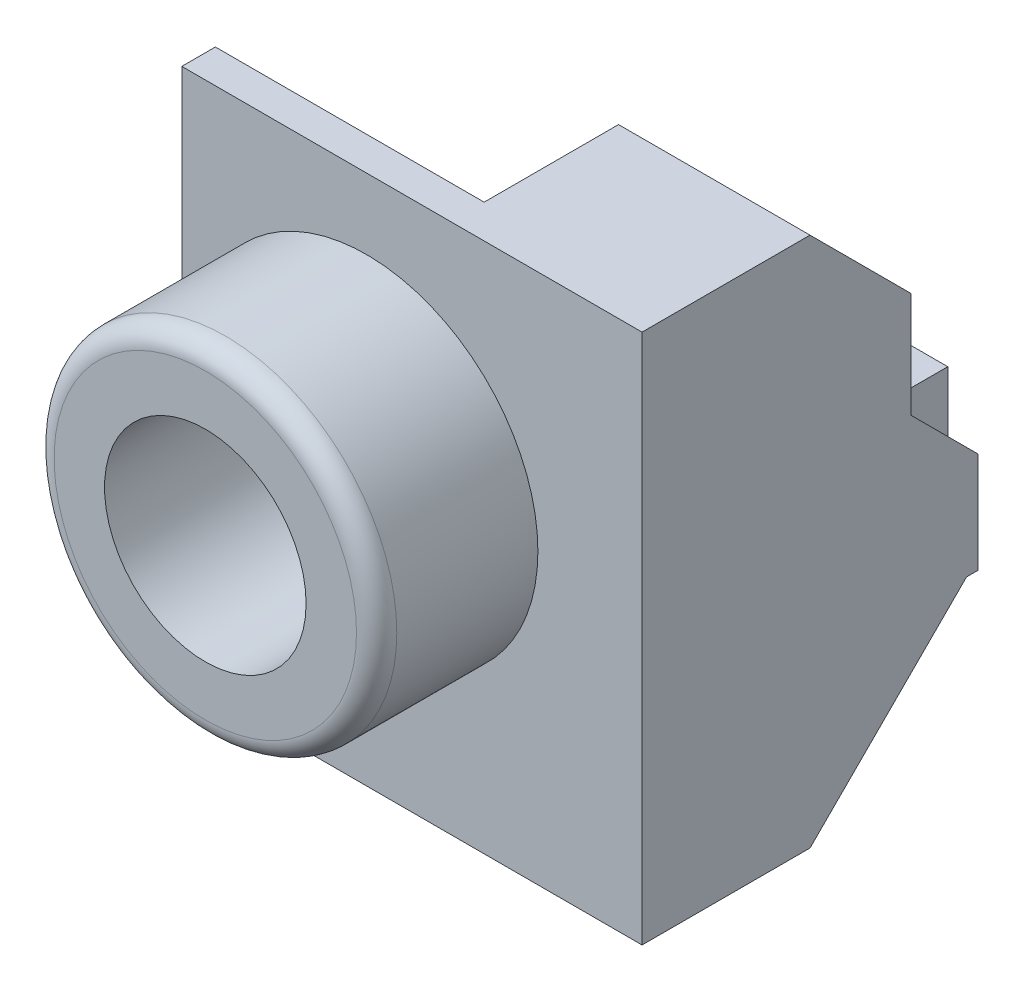
from build123d import *

# Parameters (mm, degrees)
SKETCH_3_R          = 5.1
EXTRUDE_1_DEPTH     = 4.8
SKETCH_4_W          = 11
SKETCH_4_H          = 15.8
EXTRUDE_2_DEPTH     = 1
SKETCH_5_R          = 1.5
EXTRUDE_3_DEPTH     = 10.8
CUT_EXTRUDE_1_DEPTH = 10.8
FILLET_1_R          = 0.6
SKETCH_8_R          = 3
CUT_EXTRUDE_2_DEPTH = 4.8
SKETCH_9_R          = 1
CUT_EXTRUDE_3_DEPTH = 1
SKETCH_10_W         = 3
SKETCH_10_H         = 15.8
EXTRUDE_4_DEPTH     = 7
CHAMFER_1_SIZE      = 3
SKETCH_11_W         = 2.584868303
SKETCH_11_H         = 3
EXTRUDE_5_DEPTH     = 10
CHAMFER_4_SIZE      = 1.6584
CHAMFER_5_SIZE      = 2
CHAMFER_6_SIZE      = 2
EXTRUDE_6_DEPTH     = 2.7


# Read off the part's stored shape, not the designer's step: Бобышка-Вытянуть6
with BuildPart() as part:
    # Эскиз3 → Бобышка-Вытянуть1 (new body)
    with BuildSketch(Plane.XY):
        with Locations((0, -6.52)):
            Circle(SKETCH_3_R)
    extrude(amount=EXTRUDE_1_DEPTH)

    # Эскиз4 → Бобышка-Вытянуть2 (add)
    with BuildSketch(Plane(origin=(0, 0, 0), x_dir=(-1, 0, 0), z_dir=(0, 0, -1))):
        with Locations((0, -7.22)):
            Rectangle(SKETCH_4_W, SKETCH_4_H)
    extrude(amount=EXTRUDE_2_DEPTH)

    # Эскиз5 → Бобышка-Вытянуть3 (add)
    with BuildSketch(Plane(origin=(0, 0, -1), x_dir=(-1, 0, 0), z_dir=(0, 0, -1))):
        with Locations(Location((-4.415131697, -8.961534596, 0), (0, 0, 136.323092078))):
            Circle(SKETCH_5_R)
    extrude(amount=EXTRUDE_3_DEPTH)

    # Эскиз6 → Вырез-Вытянуть1 (cut)
    with BuildSketch(Plane.XY.offset(-1)):
        with BuildLine():
            Line((5.5, -7.925648132), (5.5, -9.997421059))
            ThreePointArc((5.5, -9.997421059), (5.915131697, -8.961534596), (5.5, -7.925648132))
        make_face()
    extrude(amount=-CUT_EXTRUDE_1_DEPTH, mode=Mode.SUBTRACT)

    # Скругление1
    fillet_1_edges = [part.edges().sort_by_distance(p)[0] for p in [
        (-5.1, -6.52, 4.8),
    ]]
    fillet(fillet_1_edges, radius=FILLET_1_R)

    # Эскиз8 → Вырез-Вытянуть2 (cut)
    with BuildSketch(Plane.XY.offset(4.8)):
        with Locations((0, -6.52)):
            Circle(SKETCH_8_R)
    extrude(amount=-CUT_EXTRUDE_2_DEPTH, mode=Mode.SUBTRACT)

    # Эскиз9 → Вырез-Вытянуть3 (cut)
    with BuildSketch(Plane.XY):
        with Locations((0, -6.52)):
            Circle(SKETCH_9_R)
    extrude(amount=-CUT_EXTRUDE_3_DEPTH, mode=Mode.SUBTRACT)

    # Эскиз10 → Бобышка-Вытянуть4 (add)
    with BuildSketch(Plane(origin=(0, 0, -1), x_dir=(-1, 0, 0), z_dir=(0, 0, -1))):
        with Locations((-4, -7.22)):
            Rectangle(SKETCH_10_W, SKETCH_10_H)
    extrude(amount=EXTRUDE_4_DEPTH)

    # Фаска1
    chamfer_1_edges = [part.edges().sort_by_distance(p)[0] for p in [
        (4, -15.12, -8),
        (4, 0.68, -8),
    ]]
    chamfer(chamfer_1_edges, length=CHAMFER_1_SIZE)

    # Эскиз11 → Бобышка-Вытянуть5 (add)
    with BuildSketch(Plane(origin=(0, 0, -11.8), x_dir=(-1, 0, 0), z_dir=(0, 0, -1))):
        with Locations((-4.207565848, -8.961534596)):
            Rectangle(SKETCH_11_W, SKETCH_11_H)
    extrude(amount=-EXTRUDE_5_DEPTH)

    # Фаска4
    chamfer_4_edges = [part.edges().sort_by_distance(p)[0] for p in [
        (4.207565848, -10.461534596, -8),
    ]]
    chamfer(chamfer_4_edges, length=CHAMFER_4_SIZE)

    # Фаска5
    chamfer_5_edges = [part.edges().sort_by_distance(p)[0] for p in [
        (4.207565848, -7.461534596, -8),
    ]]
    chamfer(chamfer_5_edges, length=CHAMFER_5_SIZE)

    # Фаска6
    # the kernel refuses this chamfer: 2 mm, written as the material it adds along each edge
    with BuildSketch(Plane(origin=(2.915131697, -0.31816862, -8), x_dir=(-0.9996219169112968, 0, 0.027495876610586487), z_dir=(0, -1, 0))) as chamfer_6_piece_1_section:
        Polygon((CHAMFER_6_SIZE * 0.999621916911, CHAMFER_6_SIZE * 0.0274958766106), (-CHAMFER_6_SIZE * 0.0274958766106, CHAMFER_6_SIZE * 0.999621916911), (0, 0), align=None)
    chamfer_6_piece_1 = extrude(amount=16.945131952, mode=Mode.PRIVATE)
    chamfer_6_piece_1 = split(chamfer_6_piece_1, bisect_by=Plane(origin=(2.709078012, -6.449232398, -8.987697802), z_dir=(0, -0.7071067811865476, 0.7071067811865476)), keep=Keep.TOP, mode=Mode.PRIVATE)
    chamfer_6_piece_1 = split(chamfer_6_piece_1, bisect_by=Plane(origin=(2.709078012, -10.461534596, -8.650263736), z_dir=(0, 1, 0)), keep=Keep.TOP, mode=Mode.PRIVATE)
    chamfer_6_piece_1 = split(chamfer_6_piece_1, bisect_by=Plane(origin=(2.5, -6.786666464, -8.650263736), z_dir=(1, 0, 0)), keep=Keep.TOP, mode=Mode.PRIVATE)
    add(chamfer_6_piece_1)
    with BuildSketch(Plane(origin=(2.915131697, -0.31816862, -8), x_dir=(-0.9996219169112968, 0, 0.027495876610586487), z_dir=(0, -1, 0))) as chamfer_6_piece_2_section:
        Polygon((CHAMFER_6_SIZE * 0.999621916911, CHAMFER_6_SIZE * 0.0274958766106), (-CHAMFER_6_SIZE * 0.0274958766106, CHAMFER_6_SIZE * 0.999621916911), (0, 0), align=None)
    chamfer_6_piece_2 = extrude(amount=16.945131952, mode=Mode.PRIVATE)
    chamfer_6_piece_2 = split(chamfer_6_piece_2, bisect_by=Plane(origin=(2.70758781, -10.461534596, -8.552675921), z_dir=(0, -1, 0)), keep=Keep.TOP, mode=Mode.PRIVATE)
    chamfer_6_piece_2 = split(chamfer_6_piece_2, bisect_by=Plane(origin=(2.70758781, -11.290827655, -8.829106941), z_dir=(0, 0.7071067811865476, 0.7071067811865476)), keep=Keep.TOP, mode=Mode.PRIVATE)
    chamfer_6_piece_2 = split(chamfer_6_piece_2, bisect_by=Plane(origin=(2.5, -11.014396635, -8.552675921), z_dir=(1, 0, 0)), keep=Keep.TOP, mode=Mode.PRIVATE)
    add(chamfer_6_piece_2)

    # Бобышка-Вытянуть6 outline → Бобышка-Вытянуть6 (add)
    with BuildSketch(Plane(origin=(5.5, 0, 0), x_dir=(0, 0, -1), z_dir=(1, 0, 0))):
        Polygon((10, -7.461534596), (8, -5.461534596), (8, -2.32), (5, 0.68), (0, 0.68), (0, -15.12), (5, -15.12), (8, -12.12), (9.6584, -10.461534596), (10, -10.461534596), align=None)
    extrude(amount=EXTRUDE_6_DEPTH)


solid = part.part
